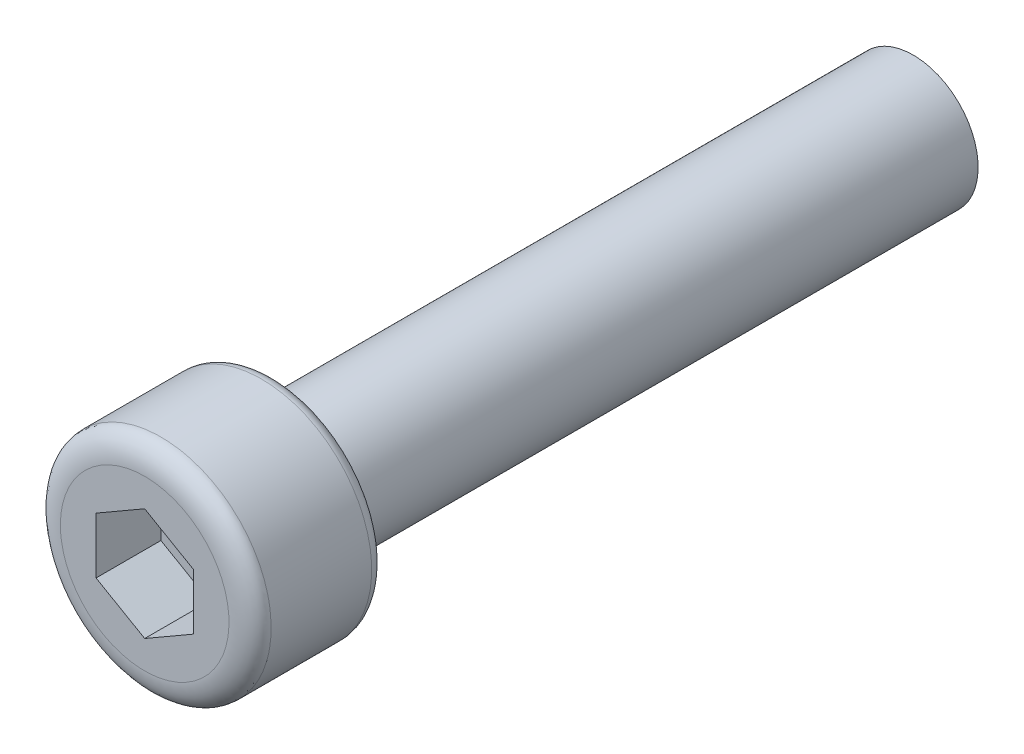
from build123d import *

# Parameters (mm, degrees)
CHAMFER_1_SIZE      = 0.3
CHAMFER_1_SIZE2     = 0.519615242
FILLET_1_R          = 0.4
FILLET_2_SIZE       = 0.5
FILLET_2_SIZE_2     = 0.8
CUT_EXTRUDE_1_DEPTH = 2


with BuildPart() as part:
    # 草图2 → 旋转1 (revolve)
    with BuildSketch(Plane(origin=(0, 0, 0), x_dir=(0, 0, -1), z_dir=(1, 0, 0)), mode=Mode.PRIVATE) as revolve_1_sk:
        Polygon((-12, 0), (-12, 3.4), (-8, 3.4), (-8, 2), (12, 2), (12, 0), align=None)
    revolve(revolve_1_sk.sketch.rotate(Axis((0, 0, -12), (0, 0, 1)), 90), axis=Axis((0, 0, -12), (0, 0, 1)))

    # 倒角1
    chamfer_1_edges = [part.edges().sort_by_distance(p)[0] for p in [
        (2, 0, -12),
    ]]
    chamfer_1_side = [part.faces().sort_by_distance(p)[0] for p in [
        (2, 0, -2),
    ]]
    chamfer(chamfer_1_edges, length=CHAMFER_1_SIZE, length2=CHAMFER_1_SIZE2, reference=chamfer_1_side[0])

    # 圆角1
    fillet_1_edges = [part.edges().sort_by_distance(p)[0] for p in [
        (3.4, 0, 8),
    ]]
    fillet(fillet_1_edges, radius=FILLET_1_R)

    # 圆角2
    # an asymmetric fillet: 0.8, 0.5 mm, written as the material it takes off along each edge
    with BuildSketch(Plane(origin=(0, 0, 12), x_dir=(-1, 0, 0), z_dir=(0, 1, 0))) as fillet_2_piece_1:
        with BuildLine():
            Bezier((3.4, -FILLET_2_SIZE), (3.4, 0), (3.4 - FILLET_2_SIZE_2, 0), weights=[1, 0.707106781, 1])
            Line((3.4 - FILLET_2_SIZE_2, 0), (3.4, 0))
            Line((3.4, 0), (3.4, -FILLET_2_SIZE))
        make_face()
    revolve(axis=Axis((0, 0, 12), (0, 0, 1)), mode=Mode.SUBTRACT)

    # 草图3 → 切除-拉伸1 (cut)
    with BuildSketch(Plane.XY.offset(12)):
        Polygon((0, 1.732050808), (-1.5, 0.866025404), (-1.5, -0.866025404), (0, -1.732050808), (1.5, -0.866025404), (1.5, 0.866025404), align=None)
    extrude(amount=-CUT_EXTRUDE_1_DEPTH, mode=Mode.SUBTRACT)


solid = part.part
